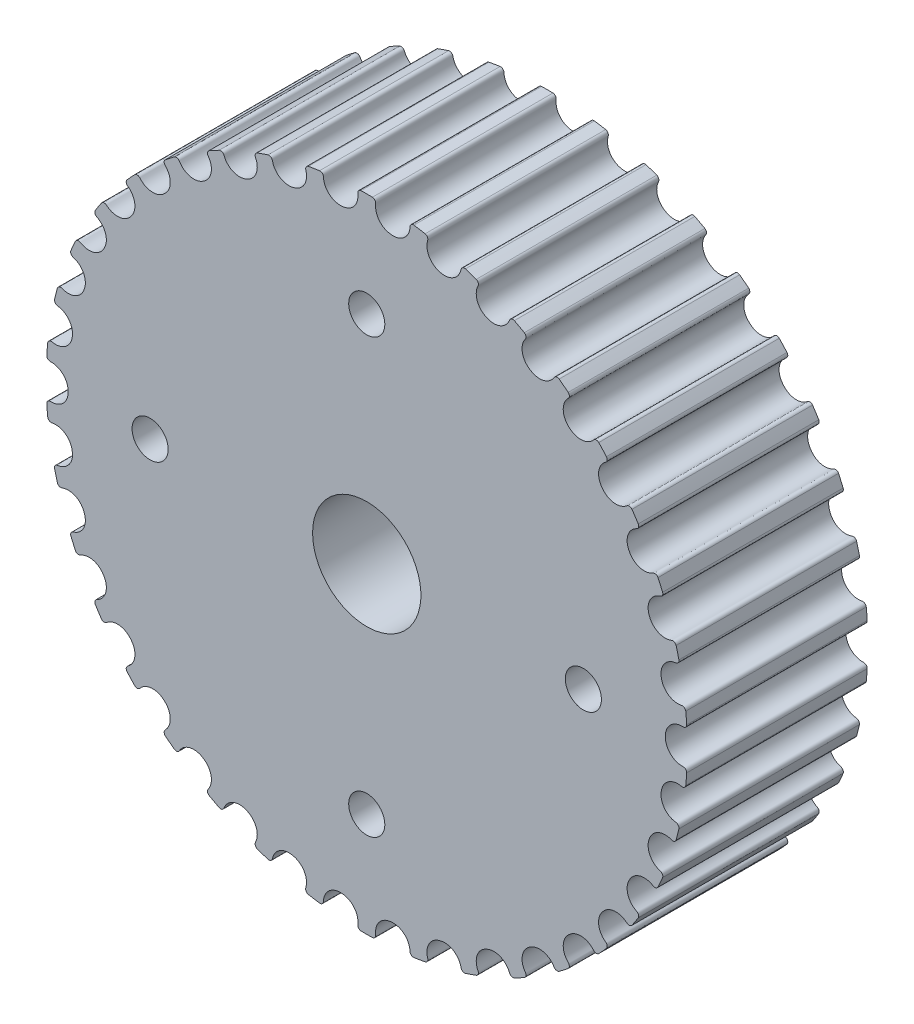
from build123d import *

# Parameters (mm, degrees)
TOOTHEXTRUDECUTGEARBELT01_DEPTH = 8.2296
PATTERNGEARBELT01_COUNT         = 38
BOREREVOLVESKETCH_W             = 19.5072
BOREREVOLVESKETCH_H             = 6.35
CUT_EXTRUDE_2_DEPTH             = 30.439215593
CUT_EXTRUDE_2_DEPTH_BACK        = 30.439215593
SKETCH_6_W                      = 23.542850768
SKETCH_6_H                      = 49.661884298
SKETCH_6_W_2                    = 10
SKETCH_6_H_2                    = 42.17926945
SKETCH_7_R                      = 19
SKETCH_7_R_2                    = 11
EXTRUDE_2_DEPTH                 = 1.5
SKETCH_8_R                      = 11
CUT_EXTRUDE_3_DEPTH             = 23.5
SKETCH_9_R                      = 11
SKETCH_9_R_2                    = 10
EXTRUDE_3_DEPTH                 = 13
CUT_EXTRUDE_START               = -19.0000001
CUT_EXTRUDE_4_OUTLINE_W         = 42
CUT_EXTRUDE_4_OUTLINE_H         = 1.5
CUT_EXTRUDE_4_DEPTH             = 38.0000001
EXTRUDE_START                   = -10
SKETCH_11_R                     = 10
EXTRUDE_4_DEPTH                 = 10
SKETCH_12_R                     = 1
CUT_EXTRUDE_5_DEPTH             = 28.011263736
SKETCH_13_R                     = 3
CUT_EXTRUDE_6_DEPTH             = 28.011263736


# Read off the part's stored shape, not the designer's step: 切除-拉伸4
with BuildPart() as part:
    # SketchRevolveGearBelt01 → GearBelt01 (revolve)
    with BuildSketch(Plane(origin=(0, 0, 0), x_dir=(0, 0, -1), z_dir=(1, 0, 0)), mode=Mode.PRIVATE) as gearbelt01_sk:
        Polygon((9.7536, 0), (9.7536, 17.126361048), (8.9916, 17.126361048), (8.9916, 17.990789824), (9.554336648, 19.349356273), (8.850340445, 19.640961048), (8.2296, 18.142361048), (8.2296, 17.761361048), (-8.2296, 17.761361048), (-8.2296, 18.142361048), (-8.850340445, 19.640961048), (-9.554336648, 19.349356273), (-8.9916, 17.990789824), (-8.9916, 17.126361048), (-9.7536, 17.126361048), (-9.7536, 0), align=None)
    revolve(gearbelt01_sk.sketch.rotate(Axis((0, 0, 0), (0, 0, -1)), 90), axis=Axis((0, 0, 0), (0, 0, -1)))

    # SketchToothGearBelt01 → ToothExtrudeCutGearBelt01 (cut, symmetric)
    with BuildSketch(Plane.XY):
        with BuildLine():
            ThreePointArc((17.723656193, 1.158614958), (17.76148579, 0), (17.723656193, -1.158614958))
            add(Edge.make_bspline(
                [(17.723656193, -1.158614958), (17.724335676, -1.14823627), (17.724077281, -1.132585151), (17.721194158, -1.111966732), (17.717777417, -1.096730895), (17.713128932, -1.081824634), (17.707279735, -1.067347346), (17.70026882, -1.05339557), (17.692142941, -1.040062338), (17.682956281, -1.027436561), (17.672770099, -1.015602429), (17.66165232, -1.004638853), (17.649677079, -0.994618949), (17.63692423, -0.9856095), (17.62347881, -0.977670704), (17.60943048, -0.970855044), (17.594872907, -0.96520967), (17.579903201, -0.960765872), (17.564621042, -0.957576996), (17.549128869, -0.95557581), (17.516665111, -0.954598043), (17.465194615, -0.955658717), (17.394665001, -0.952974324), (17.322442429, -0.94419054), (17.251120537, -0.929864538), (17.181142601, -0.909971652), (17.112937405, -0.88466435), (17.046924504, -0.854090084), (16.983509536, -0.818438939), (16.923082288, -0.777929454), (16.866014153, -0.732810765), (16.812655887, -0.683360139), (16.76333544, -0.629881524), (16.718355954, -0.572703607), (16.677993853, -0.512177819), (16.642497327, -0.44867616), (16.612084116, -0.382588948), (16.586942746, -0.314322278), (16.567221777, -0.244296084), (16.553064674, -0.172939449), (16.544475394, -0.100695852), (16.542532207, -0.047557361), (16.542623513, -0.014000083), (16.542610816, 0), (16.542623513, 0.014000083), (16.542532207, 0.047557361), (16.544475394, 0.100695852), (16.553064674, 0.172939449), (16.567221777, 0.244296084), (16.586942746, 0.314322278), (16.612084116, 0.382588948), (16.642497327, 0.44867616), (16.677993853, 0.512177819), (16.718355954, 0.572703607), (16.76333544, 0.629881524), (16.812655887, 0.683360139), (16.866014153, 0.732810765), (16.923082288, 0.777929454), (16.983509536, 0.818438939), (17.046924504, 0.854090084), (17.112937405, 0.88466435), (17.181142601, 0.909971652), (17.251120537, 0.929864538), (17.322442429, 0.94419054), (17.394665001, 0.952974324), (17.465194615, 0.955658717), (17.516665111, 0.954598043), (17.549128869, 0.95557581), (17.564621042, 0.957576996), (17.579903201, 0.960765872), (17.594872907, 0.96520967), (17.60943048, 0.970855044), (17.62347881, 0.977670704), (17.63692423, 0.9856095), (17.649677079, 0.994618949), (17.66165232, 1.004638853), (17.672770099, 1.015602429), (17.682956281, 1.027436561), (17.692142941, 1.040062338), (17.70026882, 1.05339557), (17.707279735, 1.067347346), (17.713128932, 1.081824634), (17.717777417, 1.096730895), (17.721194158, 1.111966732), (17.724077281, 1.132585151), (17.724335676, 1.14823627), (17.723656193, 1.158614958)],
                knots=[0, 0, 0, 0, 0.008387202, 0.012580803, 0.016774404, 0.020968005, 0.025161606, 0.029355207, 0.033548808, 0.037742409, 0.04193601, 0.046129611, 0.050323212, 0.054516813, 0.058710414, 0.062904015, 0.067097616, 0.071291217, 0.075484818, 0.079678419, 0.08387202, 0.101664119, 0.121204489, 0.14074486, 0.16028523, 0.179825601, 0.199365971, 0.218906342, 0.238446712, 0.257987083, 0.277527453, 0.297067824, 0.316608194, 0.336148565, 0.355688935, 0.375229306, 0.394769676, 0.414310047, 0.433850417, 0.453390788, 0.472931158, 0.492471529, 0.496235765, 0.5, 0.503764235, 0.507528471, 0.527068842, 0.546609212, 0.566149583, 0.585689953, 0.605230324, 0.624770694, 0.644311065, 0.663851435, 0.683391806, 0.702932176, 0.722472547, 0.742012917, 0.761553288, 0.781093658, 0.800634029, 0.820174399, 0.83971477, 0.85925514, 0.878795511, 0.898335881, 0.91612798, 0.920321581, 0.924515182, 0.928708783, 0.932902384, 0.937095985, 0.941289586, 0.945483187, 0.949676788, 0.953870389, 0.95806399, 0.962257591, 0.966451192, 0.970644793, 0.974838394, 0.979031995, 0.983225596, 0.987419197, 0.991612798, 1, 1, 1, 1], degree=3))
        make_face()
    toothextrudecutgearbelt01 = extrude(amount=TOOTHEXTRUDECUTGEARBELT01_DEPTH, both=True, mode=Mode.SUBTRACT)

    # PatternGearBelt01: ToothExtrudeCutGearBelt01 ×38 about axis
    patterngearbelt01_axis = Axis((0, 0, 55), (0, 0, -1))
    for i in range(1, PATTERNGEARBELT01_COUNT):
        add(toothextrudecutgearbelt01.rotate(patterngearbelt01_axis, i * 360 / PATTERNGEARBELT01_COUNT), mode=Mode.SUBTRACT)

    # BoreRevolveSketch → BoreRevolveCut (revolve, cut)
    with BuildSketch(Plane(origin=(0, 0, 0), x_dir=(0, 0, -1), z_dir=(1, 0, 0)), mode=Mode.PRIVATE) as borerevolvecut_sk:
        with Locations((0, 3.175)):
            Rectangle(BOREREVOLVESKETCH_W, BOREREVOLVESKETCH_H)
    revolve(borerevolvecut_sk.sketch.rotate(Axis((0, 0, 0), (0, 0, -1)), 90), axis=Axis((0, 0, 0), (0, 0, -1)), mode=Mode.SUBTRACT)

    # 草图6 → 切除-拉伸2 (cut, two sides: drawn at the far end of the back side and taken through both)
    with BuildSketch(Plane(origin=(0, 0, 0), x_dir=(0, 0, -1), z_dir=(1, 0, 0)).offset(-CUT_EXTRUDE_2_DEPTH_BACK)):
        Rectangle(SKETCH_6_W, SKETCH_6_H)
        Rectangle(SKETCH_6_W_2, SKETCH_6_H_2, mode=Mode.SUBTRACT)
    extrude(amount=CUT_EXTRUDE_2_DEPTH + CUT_EXTRUDE_2_DEPTH_BACK, mode=Mode.SUBTRACT)

    # 草图7 → 凸台-拉伸2 (add)
    with BuildSketch(Plane.XY.offset(5)):
        Circle(SKETCH_7_R)
        Circle(SKETCH_7_R_2, mode=Mode.SUBTRACT)
    extrude_2 = extrude(amount=EXTRUDE_2_DEPTH)

    # 镜向1: 凸台-拉伸2 across plane
    add(extrude_2.mirror(Plane.XY))

    # 草图8 → 切除-拉伸3 (cut)
    with BuildSketch(Plane.XY.offset(5)):
        Circle(SKETCH_8_R)
    extrude(amount=-CUT_EXTRUDE_3_DEPTH, mode=Mode.SUBTRACT)

    # 草图9 → 凸台-拉伸3 (add)
    with BuildSketch(Plane.XY.offset(6.5)):
        Circle(SKETCH_9_R)
        Circle(SKETCH_9_R_2, mode=Mode.SUBTRACT)
    extrude(amount=-EXTRUDE_3_DEPTH)

    # 切除-拉伸4 outline → 切除-拉伸4 (cut)
    with BuildSketch(Plane(origin=(0, 0, 0), x_dir=(1, 0, 0), z_dir=(0, 1, 0)).offset(CUT_EXTRUDE_START)):
        with Locations((0, 5.75)):
            Rectangle(CUT_EXTRUDE_4_OUTLINE_W, CUT_EXTRUDE_4_OUTLINE_H)
        with Locations((0, -5.75)):
            Rectangle(CUT_EXTRUDE_4_OUTLINE_W, CUT_EXTRUDE_4_OUTLINE_H)
    extrude(amount=CUT_EXTRUDE_4_DEPTH, mode=Mode.SUBTRACT)

    # 草图11 → 凸台-拉伸4 (add)
    with BuildSketch(Plane(origin=(0, 0, -5), x_dir=(-1, 0, 0), z_dir=(0, 0, -1)).offset(EXTRUDE_START)):
        Circle(SKETCH_11_R)
    extrude(amount=EXTRUDE_4_DEPTH)

    # 草图12 → 切除-拉伸5 (cut, through all)
    with BuildSketch(Plane(origin=(0, 0, -5), x_dir=(-1, 0, 0), z_dir=(0, 0, -1))):
        with Locations((0, 12)):
            Circle(SKETCH_12_R)
        with Locations((12, 0)):
            Circle(SKETCH_12_R)
        with Locations((0, -12)):
            Circle(SKETCH_12_R)
        with Locations((-12, 0)):
            Circle(SKETCH_12_R)
    extrude(amount=-CUT_EXTRUDE_5_DEPTH, mode=Mode.SUBTRACT)

    # 草图13 → 切除-拉伸6 (cut, through all)
    with BuildSketch(Plane(origin=(0, 0, -5), x_dir=(-1, 0, 0), z_dir=(0, 0, -1))):
        Circle(SKETCH_13_R)
    extrude(amount=-CUT_EXTRUDE_6_DEPTH, mode=Mode.SUBTRACT)


solid = part.part
